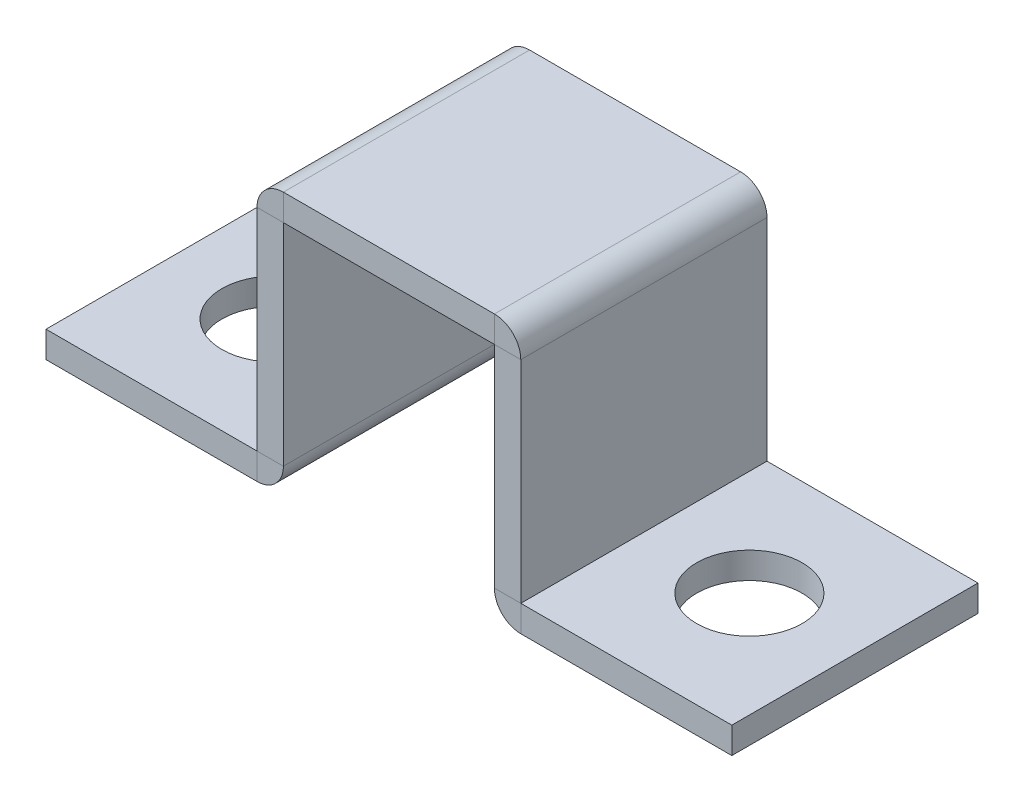
from build123d import *

# Parameters (mm, degrees)
SM_START               = -7
SM_BASE_FLANGE_1_DEPTH = 14
SKETCH_6_R             = 3
CUT_EXTRUDE_1_DEPTH    = 10


# Read off the part's stored shape, not the designer's step: 基体-法兰1
with BuildPart() as part:
    # 基体-法兰1 outline → 基体-法兰1 (new body)
    with BuildSketch(Plane.XY.offset(SM_START)):
        with BuildLine():
            Line((7.5, -1.5), (19.5, -1.5))
            Line((19.5, -1.5), (19.5, 0))
            Line((19.5, 0), (7.5, 0))
            Line((7.5, 0), (7.5, 12))
            ThreePointArc((7.5, 12), (7.060660172, 13.060660172), (6, 13.5))
            Line((6, 13.5), (-6, 13.5))
            ThreePointArc((-6, 13.5), (-7.060660172, 13.060660172), (-7.5, 12))
            Line((-7.5, 12), (-7.5, 0))
            Line((-7.5, 0), (-19.5, 0))
            Line((-19.5, 0), (-19.5, -1.5))
            Line((-19.5, -1.5), (-7.5, -1.5))
            ThreePointArc((-7.5, -1.5), (-6.439339828, -1.060660172), (-6, 0))
            Line((-6, 0), (-6, 12))
            Line((-6, 12), (6, 12))
            Line((6, 12), (6, 0))
            ThreePointArc((6, 0), (6.439339828, -1.060660172), (7.5, -1.5))
        make_face()
    extrude(amount=SM_BASE_FLANGE_1_DEPTH)

    # 草图6 → 切除-拉伸1 (cut)
    with BuildSketch(Plane(origin=(0, 0, 0), x_dir=(1, 0, 0), z_dir=(0, 1, 0))):
        with Locations(Location((-13.5, 0, 0), (0, 0, 270))):
            Circle(SKETCH_6_R)
        with Locations(Location((13.5, 0, 0), (0, 0, 270))):
            Circle(SKETCH_6_R)
    extrude(amount=-CUT_EXTRUDE_1_DEPTH, mode=Mode.SUBTRACT)


solid = part.part
